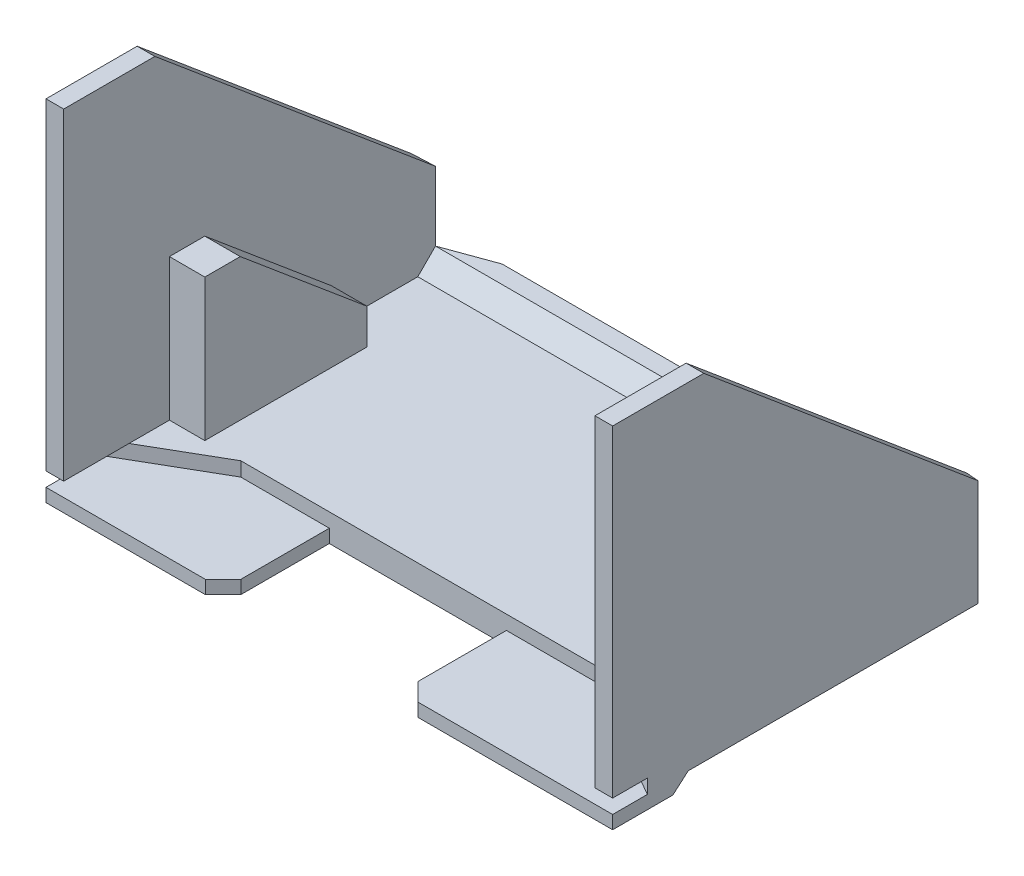
from build123d import *

# Parameters (mm, degrees)
BOSS_EXTRUDE1_DEPTH      = 34
BOSS_EXTRUDE1_DEPTH_BACK = 30
SKETCH2_W                = 60
SKETCH2_H                = 44
CUT_EXTRUDE1_DEPTH       = 36.4
CUT_EXTRUDE2_DEPTH       = 1.6
BOSS_EXTRUDE2_DEPTH      = 1.5
CHAMFER1_SIZE            = 2
CUT_EXTRUDE3_REACH       = 70.207
SKETCH8_W                = 20
SKETCH8_H                = 12
CUT_EXTRUDE4_DEPTH       = 1.5
BOSS_EXTRUDE3_REACH      = 86.994
CUT_EXTRUDE7_REACH       = 61.23
SKETCH12_W               = 52
SKETCH12_H               = 18.301043111
CHAMFER2_SIZE            = 2
BOSS_EXTRUDE4_DEPTH      = 60
BOSS_EXTRUDE5_DEPTH      = 2


with BuildPart() as part:
    # Sketch1 → Boss-Extrude1 (new, two sides: drawn at the far end of the back side and taken through both)
    with BuildSketch(Plane(origin=(0, 0, 0), x_dir=(0, 0, -1), z_dir=(1, 0, 0)).offset(-BOSS_EXTRUDE1_DEPTH_BACK)):
        Polygon((0, 38), (0, 0), (44, 0), (44, 9.717345174), (10.294044503, 38), align=None)
    extrude(amount=BOSS_EXTRUDE1_DEPTH + BOSS_EXTRUDE1_DEPTH_BACK)

    # Sketch2 → Cut-Extrude1 (cut)
    with BuildSketch(Plane(origin=(0, 38, 0), x_dir=(1, 0, 0), z_dir=(0, 1, 0))):
        with Locations((2, 22)):
            Rectangle(SKETCH2_W, SKETCH2_H)
    extrude(amount=-CUT_EXTRUDE1_DEPTH, mode=Mode.SUBTRACT)

    # Sketch5 → Cut-Extrude2 (cut)
    with BuildSketch(Plane.XZ):
        Polygon((-20, -12), (20, -12), (34, -3.917096231), (34, 0), (-30, 0), (-30, -6.226497308), align=None)
    extrude(amount=-CUT_EXTRUDE2_DEPTH, mode=Mode.SUBTRACT)

    # Sketch6 → Boss-Extrude2 (add)
    with BuildSketch(Plane.XZ):
        Polygon((-30, 0), (-30, -8.535898385), (-20.535898385, -14), (20.535898385, -14), (34, -6.226497308), (34, 0), align=None)
    extrude(amount=BOSS_EXTRUDE2_DEPTH)

    # Chamfer1
    # the kernel refuses this chamfer: 2 mm, written as the material it adds along each edge
    with BuildSketch(Plane(origin=(16.081612789, 0, -16.571682988), x_dir=(0.4998109584556485, 0.027495876610586344, -0.8656979742248803), z_dir=(0.8660254037844386, 0, 0.5000000000000001))) as chamfer1_piece_1_section:
        Polygon((CHAMFER1_SIZE * 0.999621916911, -CHAMFER1_SIZE * 0.0274958766106), (-CHAMFER1_SIZE * 0.0274958766106, -CHAMFER1_SIZE * 0.999621916911), (0, 0), align=None)
    chamfer1_piece_1 = extrude(amount=25.833737336, mode=Mode.PRIVATE)
    chamfer1_piece_1 = split(chamfer1_piece_1, bisect_by=Plane(origin=(34, -0.590941393, -10.495986371), z_dir=(-1, 0, 0)), keep=Keep.TOP, mode=Mode.PRIVATE)
    chamfer1_piece_1 = split(chamfer1_piece_1, bisect_by=Plane(origin=(27.930870364, -0.590941393, -14), z_dir=(0, 0, 1)), keep=Keep.TOP, mode=Mode.PRIVATE)
    chamfer1_piece_1 = split(chamfer1_piece_1, bisect_by=Plane(origin=(27.930870364, -1.5, -10.495986371), z_dir=(0, 1, 0)), keep=Keep.TOP, mode=Mode.PRIVATE)
    add(chamfer1_piece_1)
    with BuildSketch(Plane(origin=(-34.454285596, 0, -5.964215397), x_dir=(-0.4998109584556484, 0.027495876610586348, -0.8656979742248804), z_dir=(0.8660254037844387, 0, -0.5))) as chamfer1_piece_2_section:
        Polygon((CHAMFER1_SIZE * 0.999621916911, -CHAMFER1_SIZE * 0.0274958766106), (-CHAMFER1_SIZE * 0.0274958766106, -CHAMFER1_SIZE * 0.999621916911), (0, 0), align=None)
    chamfer1_piece_2 = extrude(amount=21.214935182, mode=Mode.PRIVATE)
    chamfer1_piece_2 = split(chamfer1_piece_2, bisect_by=Plane(origin=(-30, -0.598869914, -11.638934736), z_dir=(1, 0, 0)), keep=Keep.TOP, mode=Mode.PRIVATE)
    chamfer1_piece_2 = split(chamfer1_piece_2, bisect_by=Plane(origin=(-25.910515002, -1.5, -11.638934736), z_dir=(0, 1, 0)), keep=Keep.TOP, mode=Mode.PRIVATE)
    chamfer1_piece_2 = split(chamfer1_piece_2, bisect_by=Plane(origin=(-25.910515002, -0.598869914, -14), z_dir=(0, 0, 1)), keep=Keep.TOP, mode=Mode.PRIVATE)
    add(chamfer1_piece_2)
    with BuildSketch(Plane(origin=(-25.679264361, 0, -14), x_dir=(0, 0.027495876610586424, -0.9996219169112968), z_dir=(1, 0, 0))) as chamfer1_piece_3_section:
        Polygon((CHAMFER1_SIZE * 0.999621916911, -CHAMFER1_SIZE * 0.0274958766106), (-CHAMFER1_SIZE * 0.0274958766106, -CHAMFER1_SIZE * 0.999621916911), (0, 0), align=None)
    chamfer1_piece_3 = extrude(amount=51.358528722, mode=Mode.PRIVATE)
    chamfer1_piece_3 = split(chamfer1_piece_3, bisect_by=Plane(origin=(4.838764491, -0.58360414, -23.062744479), z_dir=(-0.5000000000000001, 0, 0.8660254037844386)), keep=Keep.TOP, mode=Mode.PRIVATE)
    chamfer1_piece_3 = split(chamfer1_piece_3, bisect_by=Plane(origin=(0, -1.5, -14.681758534), z_dir=(0, 1, 0)), keep=Keep.TOP, mode=Mode.PRIVATE)
    chamfer1_piece_3 = split(chamfer1_piece_3, bisect_by=Plane(origin=(-4.838764491, -0.58360414, -23.062744479), z_dir=(0.5, 0, 0.8660254037844387)), keep=Keep.TOP, mode=Mode.PRIVATE)
    add(chamfer1_piece_3)
    with BuildSketch(Plane(origin=(16.081612789, 0, -16.571682988), x_dir=(0.4998109584556485, 0.027495876610586344, -0.8656979742248803), z_dir=(0.8660254037844386, 0, 0.5000000000000001))) as chamfer1_piece_4a_section:
        Polygon((CHAMFER1_SIZE * 0.999621916911, -CHAMFER1_SIZE * 0.0274958766106), (-CHAMFER1_SIZE * 0.0274958766106, -CHAMFER1_SIZE * 0.999621916911), (0, 0), align=None)
    chamfer1_piece_4a = extrude(amount=25.833737336, mode=Mode.PRIVATE)
    chamfer1_piece_4a = split(chamfer1_piece_4a, bisect_by=Plane(origin=(19.272748758, -0.548768343, -14), z_dir=(0, 0, -1)), keep=Keep.TOP, mode=Mode.PRIVATE)
    chamfer1_piece_4a = split(chamfer1_piece_4a, bisect_by=Plane(origin=(19.272748758, -1.5, -15.619778524), z_dir=(0, 1, 0)), keep=Keep.TOP, mode=Mode.PRIVATE)
    with BuildSketch(Plane(origin=(-25.679264361, 0, -14), x_dir=(0, 0.027495876610586424, -0.9996219169112968), z_dir=(1, 0, 0))) as chamfer1_piece_4b_section:
        Polygon((CHAMFER1_SIZE * 0.999621916911, -CHAMFER1_SIZE * 0.0274958766106), (-CHAMFER1_SIZE * 0.0274958766106, -CHAMFER1_SIZE * 0.999621916911), (0, 0), align=None)
    chamfer1_piece_4b = extrude(amount=51.358528722, mode=Mode.PRIVATE)
    chamfer1_piece_4b = split(chamfer1_piece_4b, bisect_by=Plane(origin=(21.62981805, -0.548768343, -13.368425187), z_dir=(0.5000000000000001, 0, -0.8660254037844386)), keep=Keep.TOP, mode=Mode.PRIVATE)
    chamfer1_piece_4b = split(chamfer1_piece_4b, bisect_by=Plane(origin=(22.439707312, -1.5, -14.771194537), z_dir=(0, 1, 0)), keep=Keep.TOP, mode=Mode.PRIVATE)
    chamfer1_piece_4 = chamfer1_piece_4a & chamfer1_piece_4b
    add(chamfer1_piece_4)
    with BuildSketch(Plane(origin=(-25.679264361, 0, -14), x_dir=(0, 0.027495876610586424, -0.9996219169112968), z_dir=(1, 0, 0))) as chamfer1_piece_5a_section:
        Polygon((CHAMFER1_SIZE * 0.999621916911, -CHAMFER1_SIZE * 0.0274958766106), (-CHAMFER1_SIZE * 0.0274958766106, -CHAMFER1_SIZE * 0.999621916911), (0, 0), align=None)
    chamfer1_piece_5a = extrude(amount=51.358528722, mode=Mode.PRIVATE)
    chamfer1_piece_5a = split(chamfer1_piece_5a, bisect_by=Plane(origin=(-22.439707312, -1.5, -14.771194537), z_dir=(0, 1, 0)), keep=Keep.TOP, mode=Mode.PRIVATE)
    chamfer1_piece_5a = split(chamfer1_piece_5a, bisect_by=Plane(origin=(-21.62981805, -0.548768343, -13.368425187), z_dir=(-0.5, 0, -0.8660254037844387)), keep=Keep.TOP, mode=Mode.PRIVATE)
    with BuildSketch(Plane(origin=(-34.454285596, 0, -5.964215397), x_dir=(-0.4998109584556484, 0.027495876610586348, -0.8656979742248804), z_dir=(0.8660254037844387, 0, -0.5))) as chamfer1_piece_5b_section:
        Polygon((CHAMFER1_SIZE * 0.999621916911, -CHAMFER1_SIZE * 0.0274958766106), (-CHAMFER1_SIZE * 0.0274958766106, -CHAMFER1_SIZE * 0.999621916911), (0, 0), align=None)
    chamfer1_piece_5b = extrude(amount=21.214935182, mode=Mode.PRIVATE)
    chamfer1_piece_5b = split(chamfer1_piece_5b, bisect_by=Plane(origin=(-19.272748758, -1.5, -15.619778524), z_dir=(0, 1, 0)), keep=Keep.TOP, mode=Mode.PRIVATE)
    chamfer1_piece_5b = split(chamfer1_piece_5b, bisect_by=Plane(origin=(-19.272748758, -0.548768343, -14), z_dir=(0, 0, -1)), keep=Keep.TOP, mode=Mode.PRIVATE)
    chamfer1_piece_5 = chamfer1_piece_5a & chamfer1_piece_5b
    add(chamfer1_piece_5)

    # Cut-Extrude3: up to this face of the body (flat: up to its plane)
    cut_extrude3_end = Plane(part.part.faces().sort_by_distance((2.35859889, 0, -29.378927014))[0])
    # Sketch7 → Cut-Extrude3 (cut, up to the picked face)
    with BuildSketch(Plane(origin=(0, 38, 0), x_dir=(1, 0, 0), z_dir=(0, 1, 0)), mode=Mode.PRIVATE) as cut_extrude3_sk1:
        Polygon((-30, 41.263838853), (-22.482459034, 44), (-30, 44), align=None)
    cut_extrude3_tool1 = split(extrude(cut_extrude3_sk1.sketch, amount=-CUT_EXTRUDE3_REACH, mode=Mode.PRIVATE), bisect_by=cut_extrude3_end, keep=Keep.BOTH, mode=Mode.PRIVATE)
    # Sketch7 → Cut-Extrude3 (cut, up to the picked face)
    with BuildSketch(Plane(origin=(0, 38, 0), x_dir=(1, 0, 0), z_dir=(0, 1, 0)), mode=Mode.PRIVATE) as cut_extrude3_sk2:
        Polygon((26.482459034, 44), (34, 41.263838853), (34, 44), align=None)
    cut_extrude3_tool2 = split(extrude(cut_extrude3_sk2.sketch, amount=-CUT_EXTRUDE3_REACH, mode=Mode.PRIVATE), bisect_by=cut_extrude3_end, keep=Keep.BOTH, mode=Mode.PRIVATE)
    add(cut_extrude3_tool1.solids().sort_by(Axis((-27.494153, 38, -43.087946), (0, -1, 0)))[0], mode=Mode.SUBTRACT)
    add(cut_extrude3_tool2.solids().sort_by(Axis((31.494153, 38, -43.087946), (0, -1, 0)))[0], mode=Mode.SUBTRACT)

    # Sketch8 → Cut-Extrude4 (cut)
    with BuildSketch(Plane(origin=(0, 0, 0), x_dir=(1, 0, 0), z_dir=(0, 1, 0))):
        with Locations((0, 6)):
            Rectangle(SKETCH8_W, SKETCH8_H)
    extrude(amount=-CUT_EXTRUDE4_DEPTH, mode=Mode.SUBTRACT)

    # Boss-Extrude3: up to this face of the body (flat: up to its plane)
    boss_extrude3_end = Plane(part.part.faces().sort_by_distance((32, 16.245464339, -17.024050876))[0])
    # Sketch11 → Boss-Extrude3 (add, up to the picked face)
    with BuildSketch(Plane(origin=(-28, 0, 0), x_dir=(0, 0, -1), z_dir=(1, 0, 0)), mode=Mode.PRIVATE) as boss_extrude3_sk1:
        Polygon((15.937131869, 17.6), (30.23817498, 5.6), (30.23817498, 1.6), (11.937131869, 1.6), (11.937131869, 17.6), align=None)
    boss_extrude3_tool1 = split(extrude(boss_extrude3_sk1.sketch, amount=BOSS_EXTRUDE3_REACH, mode=Mode.PRIVATE), bisect_by=boss_extrude3_end, keep=Keep.BOTH, mode=Mode.PRIVATE)
    add(boss_extrude3_tool1.solids().sort_by(Axis((-28, 7.941992, -19.27068), (1, 0, 0)))[0])

    # Cut-Extrude7: up to this face of the body (flat: up to its plane)
    cut_extrude7_end = Plane(part.part.faces().sort_by_distance((2, 1.6, -37.034599694))[0])
    # Sketch12 → Cut-Extrude7 (cut, up to the picked face)
    with BuildSketch(Plane(origin=(0, 17.6, 0), x_dir=(1, 0, 0), z_dir=(0, 1, 0)), mode=Mode.PRIVATE) as cut_extrude7_sk1:
        with Locations((2, 21.087653425)):
            Rectangle(SKETCH12_W, SKETCH12_H)
    cut_extrude7_tool1 = split(extrude(cut_extrude7_sk1.sketch, amount=-CUT_EXTRUDE7_REACH, mode=Mode.PRIVATE), bisect_by=cut_extrude7_end, keep=Keep.BOTH, mode=Mode.PRIVATE)
    add(cut_extrude7_tool1.solids().sort_by(Axis((2, 17.6, -21.087653), (0, -1, 0)))[0], mode=Mode.SUBTRACT)

    # Chamfer2
    chamfer2_edges = [part.edges().sort_by_distance(p)[0] for p in [
        (10, -0.75, 0),
        (-10, -0.75, 0),
    ]]
    chamfer(chamfer2_edges, length=CHAMFER2_SIZE)

    # Sketch14 → Boss-Extrude4 (add)
    with BuildSketch(Plane(origin=(-28, 0, 0), x_dir=(0, 0, -1), z_dir=(1, 0, 0))):
        Polygon((41.991779322, 3.6), (41.991779322, 1.6), (39.991779322, 1.6), align=None)
    extrude(amount=BOSS_EXTRUDE4_DEPTH)

    # Sketch15 → Boss-Extrude5 (add)
    with BuildSketch(Plane(origin=(0, 1.6, 0), x_dir=(1, 0, 0), z_dir=(0, 1, 0))):
        Polygon((-28, 41.991779322), (32, 41.991779322), (26.482459034, 44), (-22.482459034, 44), align=None)
    extrude(amount=BOSS_EXTRUDE5_DEPTH)


solid = part.part
